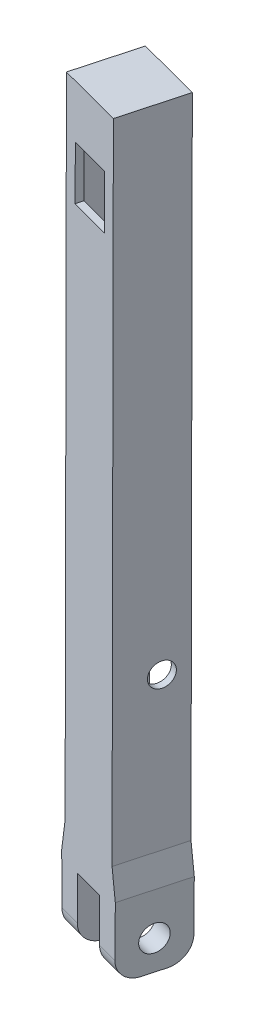
from build123d import *

# Parameters (mm, degrees)
BOSS_EXTRUDE1_DEPTH = 9
SKETCH2_R           = 1.8
CUT_EXTRUDE1_DEPTH  = 11.5
SHELL1_T            = -1
FILLET3_R           = 3
SKETCH5_R           = 1.65
CUT_EXTRUDE4_DEPTH  = 16
SKETCH6_W           = 5.761789727
SKETCH6_H           = 7.4
CUT_EXTRUDE5_DEPTH  = 3


with BuildPart() as part:
    # Sketch1 → Boss-Extrude1 (new body)
    with BuildSketch(Plane(origin=(-8.550148724, 0.150483818, 31.909921865), x_dir=(0.9659203418587706, 0.0049942121419566075, 0.2587913271895271), z_dir=(-0.2588138443395903, 0.004555159989206847, 0.96591647904756))):
        Polygon((-2.116672777, -0.00038458), (-5.116672777, -0.00038458), (-5.208111757, 9.999197357), (-4.549568011, 13.944614969), (-4.549568011, 103.944614969), (4.716222456, 103.944614969), (4.716222456, 13.944614969), (5.374766202, 9.999197357), (5.283327223, -0.00038458), (2.283327223, -0.00038458), (2.283327223, 8.99961542), (-2.116672777, 8.99961542), align=None)
    extrude(amount=-BOSS_EXTRUDE1_DEPTH)

    # Sketch2 → Cut-Extrude1 (cut, symmetric)
    with BuildSketch(Plane(origin=(-2.044537293, -0.010571113, -0.547776557), x_dir=(0.2588168701543083, -0.005411250453060186, -0.9659112516644903), z_dir=(0.9659203418587706, 0.0049942121419806335, 0.2587913271895269))):
        with Locations(Location((-28.539422387, 4.100183989, 0), (0, 0, 180.310047193))):
            Circle(SKETCH2_R)
    extrude(amount=CUT_EXTRUDE1_DEPTH, both=True, mode=Mode.SUBTRACT)

    # Shell1
    shell1_openings = [part.faces().sort_by_distance(p)[0] for p in [
        (-6.334444908, 53.359699464, 22.935106903),
    ]]
    offset(amount=SHELL1_T, openings=shell1_openings, kind=Kind.INTERSECTION)

    # Fillet3
    # the kernel refuses this fillet: 3 mm, written as the material it takes off along each edge
    with BuildSketch(Plane(origin=(-3.35028205, 0.176984725, 33.303082451), x_dir=(0.2588138443395903, -0.004555159989206649, -0.9659164790475598), z_dir=(-0.9659203418587717, -0.004994212141671299, -0.25879132718952874))) as fillet3_piece_1:
        with BuildLine():
            CenterArc((FILLET3_R, -FILLET3_R), FILLET3_R, 90, 90)
            Line((0, -FILLET3_R), (0, 0))
            Line((0, 0), (FILLET3_R, 0))
        make_face()
    extrude(amount=18, mode=Mode.SUBTRACT)
    with BuildSketch(Plane(origin=(-1.020957451, 0.135988285, 24.609834139), x_dir=(-0.25881384433959026, 0.004555159989206952, 0.9659164790475598), z_dir=(-0.9659203418587717, -0.004994212141671299, -0.25879132718952874)), Plane(origin=(6.126853079, 0.172945455, 26.52488996), x_dir=(-0.25881384433959026, 0.004555159989206913, 0.9659164790475598), z_dir=(-0.9659203418587694, -0.004994212142289673, -0.2587913271895252)), Plane(origin=(3.797528479, 0.213941895, 35.218138272), x_dir=(-0.0036451559089296618, 0.9999771539203036, -0.005692492937989095), z_dir=(-0.9659203418587694, -0.004994212142289673, -0.2587913271895252))) as fillet3_piece_2:
        with BuildLine():
            CenterArc((FILLET3_R, FILLET3_R), FILLET3_R, 180, 90)
            Line((0, FILLET3_R), (0, 0))
            Line((0, 0), (FILLET3_R, 0))
        make_face()
    extrude(amount=18, mode=Mode.SUBTRACT)

    # Sketch5 → Cut-Extrude4 (cut)
    with BuildSketch(Plane(origin=(4.555495207, 0.023553815, 1.220517469), x_dir=(0.2587878680955358, 0.0013380415103731802, -0.9659332528552292), z_dir=(0.9659203418587695, 0.0049942121422931664, 0.25879132718952524))):
        with Locations(Location((-27.180645186, 35.235580785, 0), (0, 0, 359.92333489))):
            Circle(SKETCH5_R)
    extrude(amount=-CUT_EXTRUDE4_DEPTH, mode=Mode.SUBTRACT)

    # Sketch6 → Cut-Extrude5 (cut)
    with BuildSketch(Plane(origin=(-8.550148724, 0.150483818, 31.909921865), x_dir=(0.9659272198142892, 0.0012205251536603987, 0.25881096642180224), z_dir=(-0.2588138443395908, 0.0045551599892071715, 0.9659164790475597))):
        with Locations((-0.252081359, 92.845441705)):
            Rectangle(SKETCH6_W, SKETCH6_H)
    extrude(amount=-CUT_EXTRUDE5_DEPTH, mode=Mode.SUBTRACT)


solid = part.part
